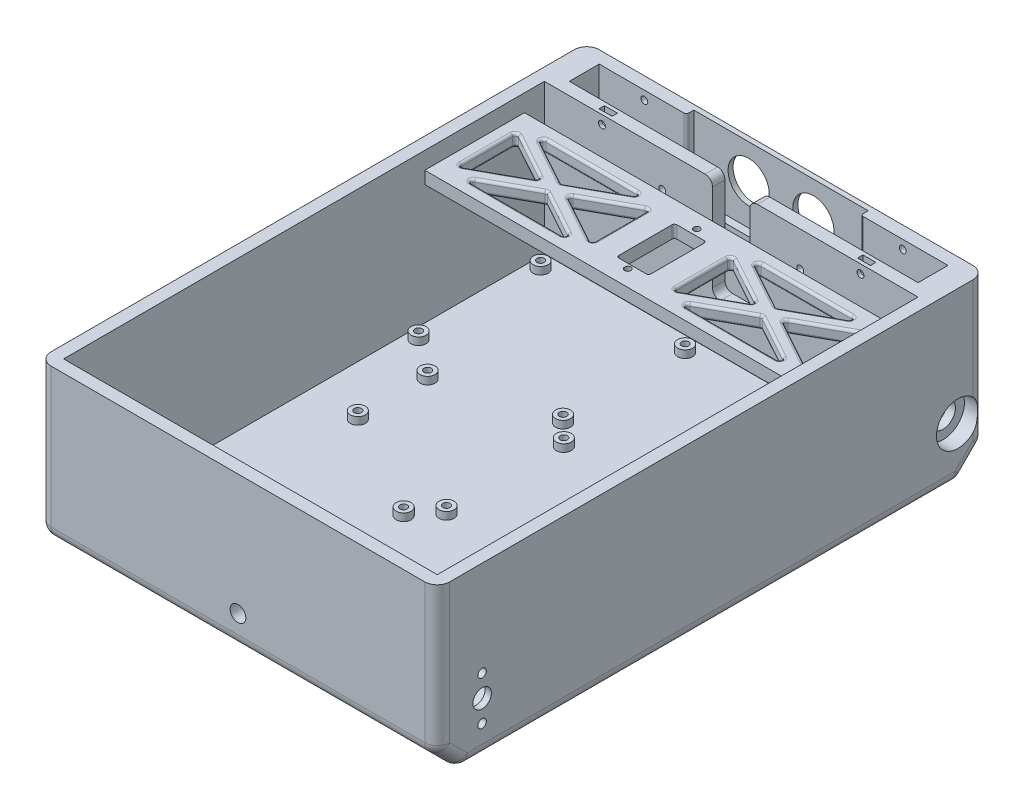
from build123d import *

# Parameters (mm, degrees)
MAIN_BODY_W          = 160
MAIN_BODY_H          = 220
MAIN_BODY_W_2        = 150
MAIN_BODY_H_2        = 210
BOSS_EXTRUDE1_DEPTH  = 8
BOSS_EXTRUDE3_START  = 8
MAIN_BODY_4_W        = 160
MAIN_BODY_4_H        = 220
MAIN_BODY_4_W_2      = 150
MAIN_BODY_4_H_2      = 210
BOSS_EXTRUDE3_DEPTH  = 60
BOSS_EXTRUDE4_DEPTH  = 150
SKETCH2_W            = 26
SKETCH2_H            = 7.5
CUT_EXTRUDE1_DEPTH   = 6
SKETCH3_W            = 5.5
SKETCH3_H            = 26
BOSS_EXTRUDE5_DEPTH  = 20
SKETCH4_W            = 5
SKETCH4_H            = 12
BOSS_EXTRUDE6_DEPTH  = 60
CUT_EXTRUDE4_REACH   = 207.728
SKETCH5_R            = 3.7
SKETCH5_R_2          = 3.5
SKETCH6_R            = 13
CUT_EXTRUDE5_DEPTH   = 2.5
CUT_EXTRUDE6_START   = -2.5
SKETCH8_R            = 13
CUT_EXTRUDE6_DEPTH   = 2.5
CUT_EXTRUDE7_REACH   = 207.728
SKETCH10_R           = 1.7
SKETCH10_R_2         = 1.25
SKETCH14_W           = 9
SKETCH14_H           = 10
BOSS_EXTRUDE9_DEPTH  = 5
CUT_EXTRUDE12_REACH  = 245.77
CUT_EXTRUDE13_REACH  = 154.066
SKETCH16_R           = 1.45
SKETCH16_R_2         = 1.475
BOSS_EXTRUDE11_REACH = 203.864
SKETCH18_W           = 40
SKETCH18_H           = 5
CUT_EXTRUDE14_REACH  = 154.066
SKETCH19_W           = 12.85
SKETCH19_H           = 23.25
CUT_EXTRUDE16_REACH  = 245.77
SKETCH21_R           = 1.375
CUT_EXTRUDE17_DEPTH  = 1.1
SKETCH23_R           = 2.5
CUT_EXTRUDE18_DEPTH  = 1.25
CUT_EXTRUDE19_REACH  = 151.108
SKETCH24_R           = 1.250177724
CUT_EXTRUDE21_REACH  = 151.108
FILLET2_R            = 1
CUT_EXTRUDE27_REACH  = 245.77
SKETCH33_R           = 8.25
CUT_EXTRUDE28_REACH  = 230.545
SKETCH34_R           = 1.375
SKETCH34_R_2         = 1.35
SKETCH35_W           = 15
SKETCH35_H           = 5
CUT_EXTRUDE29_DEPTH  = 41
FILLET4_R            = 3
FILLET5_R            = 1
SKETCH36_W           = 70
SKETCH36_H           = 3
CUT_EXTRUDE30_DEPTH  = 30
FILLET6_R            = 1
SKETCH37_R           = 3
SKETCH37_R_2         = 1.45
SKETCH37_R_3         = 1.475
BOSS_EXTRUDE12_DEPTH = 3
SKETCH38_R           = 8.625
CUT_EXTRUDE31_DEPTH  = 6
SKETCH39_R           = 5
CUT_EXTRUDE32_DEPTH  = 3.5
CHAMFER1_SIZE        = 10
FILLET7_R            = 5


with BuildPart() as part:
    # Main Body → Boss-Extrude1 (new body)
    # profile 1 of 2: a face of its own
    with BuildSketch(Plane(origin=(0, 0, 0), x_dir=(1, 0, 0), z_dir=(0, 1, 0))):
        Rectangle(MAIN_BODY_W, MAIN_BODY_H)
        Rectangle(MAIN_BODY_W_2, MAIN_BODY_H_2, mode=Mode.SUBTRACT)
    # profile 2 of 2: a face of its own
    with BuildSketch(Plane(origin=(0, 0, 0), x_dir=(1, 0, 0), z_dir=(0, 1, 0))):
        Rectangle(MAIN_BODY_W_2, MAIN_BODY_H_2)
    extrude(amount=BOSS_EXTRUDE1_DEPTH)

    # Main Body<4> → Boss-Extrude3 (add)
    with BuildSketch(Plane(origin=(0, 0, 0), x_dir=(1, 0, 0), z_dir=(0, 1, 0)).offset(BOSS_EXTRUDE3_START)):
        Rectangle(MAIN_BODY_4_W, MAIN_BODY_4_H)
        Rectangle(MAIN_BODY_4_W_2, MAIN_BODY_4_H_2, mode=Mode.SUBTRACT)
    extrude(amount=BOSS_EXTRUDE3_DEPTH)

    # Sketch1 → Boss-Extrude4 (add)
    with BuildSketch(Plane.ZY.offset(-75)):
        with BuildLine():
            Line((80.220781011, 15.5), (79, 15.5))
            Line((79, 15.5), (79, 8))
            Line((79, 8), (92, 8))
            ThreePointArc((92, 8), (85.017879978, 10.0341439), (80.220781011, 15.5))
        make_face()
        with BuildLine():
            Line((105, 15.5), (103.779218989, 15.5))
            ThreePointArc((103.779218989, 15.5), (98.982120022, 10.0341439), (92, 8))
            Line((92, 8), (105, 8))
            Line((105, 8), (105, 15.5))
        make_face()
    extrude(amount=BOSS_EXTRUDE4_DEPTH)

    # Sketch2 → Cut-Extrude1 (cut, symmetric)
    with BuildSketch(Plane(origin=(0, 0, 0), x_dir=(0, 0, -1), z_dir=(1, 0, 0))):
        with Locations((-92, 11.75)):
            Rectangle(SKETCH2_W, SKETCH2_H)
    extrude(amount=CUT_EXTRUDE1_DEPTH, both=True, mode=Mode.SUBTRACT)

    # Sketch3 → Boss-Extrude5 (add)
    with BuildSketch(Plane(origin=(0, 8, 0), x_dir=(1, 0, 0), z_dir=(0, 1, 0))):
        with Locations((-7.25, -92)):
            Rectangle(SKETCH3_W, SKETCH3_H)
        with Locations((7.25, -92)):
            Rectangle(SKETCH3_W, SKETCH3_H)
    extrude(amount=BOSS_EXTRUDE5_DEPTH)

    # Sketch4 → Boss-Extrude6 (add)
    with BuildSketch(Plane(origin=(0, 8, 0), x_dir=(1, 0, 0), z_dir=(0, 1, 0))):
        Polygon((-70, 93), (-75, 93), (-75, 88), (75, 88), (75, 93), (70, 93), align=None)
        with Locations((72.5, 99)):
            Rectangle(SKETCH4_W, SKETCH4_H)
        with Locations((-72.5, 99)):
            Rectangle(SKETCH4_W, SKETCH4_H)
    extrude(amount=BOSS_EXTRUDE6_DEPTH)

    # Sketch5 → Cut-Extrude4 (cut, up to next)
    with BuildSketch(Plane(origin=(80, 0, 0), x_dir=(0, 0, -1), z_dir=(1, 0, 0)), mode=Mode.PRIVATE) as cut_extrude4_sk1:
        with Locations((-92, 21)):
            Circle(SKETCH5_R)
        with Locations((-92, 21)):
            Circle(SKETCH5_R_2, mode=Mode.SUBTRACT)
    cut_extrude4_tool1 = extrude(cut_extrude4_sk1.sketch, amount=-CUT_EXTRUDE4_REACH, mode=Mode.PRIVATE) & part.part
    # Sketch5 → Cut-Extrude4 (cut, up to next)
    with BuildSketch(Plane(origin=(80, 0, 0), x_dir=(0, 0, -1), z_dir=(1, 0, 0)), mode=Mode.PRIVATE) as cut_extrude4_sk2:
        with Locations((-92, 21)):
            Circle(SKETCH5_R_2)
    cut_extrude4_tool2 = extrude(cut_extrude4_sk2.sketch, amount=-CUT_EXTRUDE4_REACH, mode=Mode.PRIVATE) & part.part
    cut_extrude4_1 = cut_extrude4_tool1.solids().sort_by_distance((80, 21, 95.595348))[0]
    add(cut_extrude4_1, mode=Mode.SUBTRACT)
    cut_extrude4_2 = cut_extrude4_tool2.solids().sort_by_distance((80, 21, 92))[0]
    add(cut_extrude4_2, mode=Mode.SUBTRACT)
    cut_extrude4 = cut_extrude4_1 + cut_extrude4_2  # Cut-Extrude4 as one shape, for the pattern or mirror that repeats it

    # Sketch6 → Cut-Extrude5 (cut)
    with BuildSketch(Plane(origin=(-75, 0, 0), x_dir=(0, 0, -1), z_dir=(1, 0, 0))):
        with Locations(Location((-92, 21, 0), (0, 0, 180))):
            Circle(SKETCH6_R)
    extrude(amount=-CUT_EXTRUDE5_DEPTH, mode=Mode.SUBTRACT)

    # Mirror1: Cut-Extrude4 across plane
    add(cut_extrude4.mirror(Plane(origin=(0, 0, 0), x_dir=(0, 0, 1), z_dir=(1, 0, 0))), mode=Mode.SUBTRACT)

    # Sketch8 → Cut-Extrude6 (cut)
    with BuildSketch(Plane.ZY.offset(-75).offset(CUT_EXTRUDE6_START)):
        with Locations((92, 21)):
            Circle(SKETCH8_R)
    extrude(amount=CUT_EXTRUDE6_DEPTH, mode=Mode.SUBTRACT)

    # Sketch10 → Cut-Extrude7 (cut, up to next)
    with BuildSketch(Plane(origin=(80, 0, 0), x_dir=(0, 0, -1), z_dir=(1, 0, 0)), mode=Mode.PRIVATE) as cut_extrude7_sk1:
        with Locations((-92, 12.25)):
            Circle(SKETCH10_R)
        with Locations((-92, 12.25)):
            Circle(SKETCH10_R_2, mode=Mode.SUBTRACT)
    cut_extrude7_tool1 = extrude(cut_extrude7_sk1.sketch, amount=-CUT_EXTRUDE7_REACH, mode=Mode.PRIVATE) & part.part
    # Sketch10 → Cut-Extrude7 (cut, up to next)
    with BuildSketch(Plane(origin=(80, 0, 0), x_dir=(0, 0, -1), z_dir=(1, 0, 0)), mode=Mode.PRIVATE) as cut_extrude7_sk2:
        with Locations((-92, 12.25)):
            Circle(SKETCH10_R_2)
    cut_extrude7_tool2 = extrude(cut_extrude7_sk2.sketch, amount=-CUT_EXTRUDE7_REACH, mode=Mode.PRIVATE) & part.part
    # Sketch10 → Cut-Extrude7 (cut, up to next)
    with BuildSketch(Plane(origin=(80, 0, 0), x_dir=(0, 0, -1), z_dir=(1, 0, 0)), mode=Mode.PRIVATE) as cut_extrude7_sk3:
        with Locations((-92, 29.75)):
            Circle(SKETCH10_R)
        with Locations((-92, 29.75)):
            Circle(SKETCH10_R_2, mode=Mode.SUBTRACT)
    cut_extrude7_tool3 = extrude(cut_extrude7_sk3.sketch, amount=-CUT_EXTRUDE7_REACH, mode=Mode.PRIVATE) & part.part
    # Sketch10 → Cut-Extrude7 (cut, up to next)
    with BuildSketch(Plane(origin=(80, 0, 0), x_dir=(0, 0, -1), z_dir=(1, 0, 0)), mode=Mode.PRIVATE) as cut_extrude7_sk4:
        with Locations((-92, 29.75)):
            Circle(SKETCH10_R_2)
    cut_extrude7_tool4 = extrude(cut_extrude7_sk4.sketch, amount=-CUT_EXTRUDE7_REACH, mode=Mode.PRIVATE) & part.part
    cut_extrude7_1 = cut_extrude7_tool1.solids().sort_by_distance((80, 12.25, 93.651917))[0]
    add(cut_extrude7_1, mode=Mode.SUBTRACT)
    cut_extrude7_2 = cut_extrude7_tool2.solids().sort_by_distance((80, 12.25, 92))[0]
    add(cut_extrude7_2, mode=Mode.SUBTRACT)
    cut_extrude7_3 = cut_extrude7_tool3.solids().sort_by_distance((80, 29.75, 93.651917))[0]
    add(cut_extrude7_3, mode=Mode.SUBTRACT)
    cut_extrude7_4 = cut_extrude7_tool4.solids().sort_by_distance((80, 29.75, 92))[0]
    add(cut_extrude7_4, mode=Mode.SUBTRACT)
    cut_extrude7 = cut_extrude7_1 + cut_extrude7_2 + cut_extrude7_3 + cut_extrude7_4  # Cut-Extrude7 as one shape, for the pattern or mirror that repeats it

    # Mirror3: Cut-Extrude7 across plane
    add(cut_extrude7.mirror(Plane(origin=(0, 0, 0), x_dir=(0, 0, 1), z_dir=(1, 0, 0))), mode=Mode.SUBTRACT)

    # Sketch14 → Boss-Extrude9 (add)
    with BuildSketch(Plane(origin=(0, 8, 0), x_dir=(1, 0, 0), z_dir=(0, 1, 0))):
        with Locations((0, -100)):
            Rectangle(SKETCH14_W, SKETCH14_H)
    extrude(amount=BOSS_EXTRUDE9_DEPTH)

    # Sketch15 → Cut-Extrude12 (cut, up to next)
    with BuildSketch(Plane.XY.offset(110), mode=Mode.PRIVATE) as cut_extrude12_sk1:
        with BuildLine():
            ThreePointArc((3.15, 19.5), (0, 22.65), (-3.15, 19.5))
            ThreePointArc((-3.15, 19.5), (0, 16.35), (3.15, 19.5))
        make_face()
    cut_extrude12_tool1 = extrude(cut_extrude12_sk1.sketch, amount=-CUT_EXTRUDE12_REACH, mode=Mode.PRIVATE) & part.part
    add(cut_extrude12_tool1.solids().sort_by_distance((0, 19.5, 110))[0], mode=Mode.SUBTRACT)

    # Sketch16 → Cut-Extrude13 (cut, up to next)
    with BuildSketch(Plane.XZ, mode=Mode.PRIVATE) as cut_extrude13_sk1:
        with Locations(Location((-12.3, 67.68, 0), (0, 0, 270))):
            Circle(SKETCH16_R)
    cut_extrude13_tool1 = extrude(cut_extrude13_sk1.sketch, amount=-CUT_EXTRUDE13_REACH, mode=Mode.PRIVATE) & part.part
    # Sketch16 → Cut-Extrude13 (cut, up to next)
    with BuildSketch(Plane.XZ, mode=Mode.PRIVATE) as cut_extrude13_sk2:
        with Locations(Location((24.2, 67.68, 0), (0, 0, 270))):
            Circle(SKETCH16_R)
    cut_extrude13_tool2 = extrude(cut_extrude13_sk2.sketch, amount=-CUT_EXTRUDE13_REACH, mode=Mode.PRIVATE) & part.part
    # Sketch16 → Cut-Extrude13 (cut, up to next)
    with BuildSketch(Plane.XZ, mode=Mode.PRIVATE) as cut_extrude13_sk3:
        with Locations(Location((37.845895281, 68.243011316, 0), (0, 0, 270))):
            Circle(SKETCH16_R)
    cut_extrude13_tool3 = extrude(cut_extrude13_sk3.sketch, amount=-CUT_EXTRUDE13_REACH, mode=Mode.PRIVATE) & part.part
    # Sketch16 → Cut-Extrude13 (cut, up to next)
    with BuildSketch(Plane.XZ, mode=Mode.PRIVATE) as cut_extrude13_sk4:
        with Locations(Location((59.554104719, 68.243011316, 0), (0, 0, 270))):
            Circle(SKETCH16_R)
    cut_extrude13_tool4 = extrude(cut_extrude13_sk4.sketch, amount=-CUT_EXTRUDE13_REACH, mode=Mode.PRIVATE) & part.part
    # Sketch16 → Cut-Extrude13 (cut, up to next)
    with BuildSketch(Plane.XZ, mode=Mode.PRIVATE) as cut_extrude13_sk5:
        with Locations(Location((-4.2, -25, 0), (0, 0, 270))):
            Circle(SKETCH16_R)
    cut_extrude13_tool5 = extrude(cut_extrude13_sk5.sketch, amount=-CUT_EXTRUDE13_REACH, mode=Mode.PRIVATE) & part.part
    # Sketch16 → Cut-Extrude13 (cut, up to next)
    with BuildSketch(Plane.XZ, mode=Mode.PRIVATE) as cut_extrude13_sk6:
        with Locations(Location((-70.5, -33, 0), (0, 0, 270))):
            Circle(SKETCH16_R)
    cut_extrude13_tool6 = extrude(cut_extrude13_sk6.sketch, amount=-CUT_EXTRUDE13_REACH, mode=Mode.PRIVATE) & part.part
    # Sketch16 → Cut-Extrude13 (cut, up to next)
    with BuildSketch(Plane.XZ, mode=Mode.PRIVATE) as cut_extrude13_sk7:
        with Locations(Location((-55, -21.12, 0), (0, 0, 270))):
            Circle(SKETCH16_R)
    cut_extrude13_tool7 = extrude(cut_extrude13_sk7.sketch, amount=-CUT_EXTRUDE13_REACH, mode=Mode.PRIVATE) & part.part
    # Sketch16 → Cut-Extrude13 (cut, up to next)
    with BuildSketch(Plane.XZ, mode=Mode.PRIVATE) as cut_extrude13_sk8:
        with Locations(Location((-55, 6.88, 0), (0, 0, 270))):
            Circle(SKETCH16_R)
    cut_extrude13_tool8 = extrude(cut_extrude13_sk8.sketch, amount=-CUT_EXTRUDE13_REACH, mode=Mode.PRIVATE) & part.part
    # Sketch16 → Cut-Extrude13 (cut, up to next)
    with BuildSketch(Plane.XZ, mode=Mode.PRIVATE) as cut_extrude13_sk9:
        with Locations(Location((-12.3, 31.18, 0), (0, 0, 270))):
            Circle(SKETCH16_R)
    cut_extrude13_tool9 = extrude(cut_extrude13_sk9.sketch, amount=-CUT_EXTRUDE13_REACH, mode=Mode.PRIVATE) & part.part
    # Sketch16 → Cut-Extrude13 (cut, up to next)
    with BuildSketch(Plane.XZ, mode=Mode.PRIVATE) as cut_extrude13_sk10:
        with Locations(Location((-4.2, 22.08, 0), (0, 0, 270))):
            Circle(SKETCH16_R)
    cut_extrude13_tool10 = extrude(cut_extrude13_sk10.sketch, amount=-CUT_EXTRUDE13_REACH, mode=Mode.PRIVATE) & part.part
    # Sketch16 → Cut-Extrude13 (cut, up to next)
    with BuildSketch(Plane.XZ, mode=Mode.PRIVATE) as cut_extrude13_sk11:
        with Locations(Location((24.2, 31.18, 0), (0, 0, 270))):
            Circle(SKETCH16_R)
    cut_extrude13_tool11 = extrude(cut_extrude13_sk11.sketch, amount=-CUT_EXTRUDE13_REACH, mode=Mode.PRIVATE) & part.part
    # Sketch16 → Cut-Extrude13 (cut, up to next)
    with BuildSketch(Plane.XZ, mode=Mode.PRIVATE) as cut_extrude13_sk12:
        with Locations(Location((37.845895281, 24.116988684, 0), (0, 0, 270))):
            Circle(SKETCH16_R)
    cut_extrude13_tool12 = extrude(cut_extrude13_sk12.sketch, amount=-CUT_EXTRUDE13_REACH, mode=Mode.PRIVATE) & part.part
    # Sketch16 → Cut-Extrude13 (cut, up to next)
    with BuildSketch(Plane.XZ, mode=Mode.PRIVATE) as cut_extrude13_sk13:
        with Locations(Location((59.554104719, 24.116988684, 0), (0, 0, 270))):
            Circle(SKETCH16_R)
    cut_extrude13_tool13 = extrude(cut_extrude13_sk13.sketch, amount=-CUT_EXTRUDE13_REACH, mode=Mode.PRIVATE) & part.part
    # Sketch16 → Cut-Extrude13 (cut, up to next)
    with BuildSketch(Plane.XZ, mode=Mode.PRIVATE) as cut_extrude13_sk14:
        with Locations(Location((-70.5, -82, 0), (0, 0, 270))):
            Circle(SKETCH16_R)
    cut_extrude13_tool14 = extrude(cut_extrude13_sk14.sketch, amount=-CUT_EXTRUDE13_REACH, mode=Mode.PRIVATE) & part.part
    # Sketch16 → Cut-Extrude13 (cut, up to next)
    with BuildSketch(Plane.XZ, mode=Mode.PRIVATE) as cut_extrude13_sk15:
        with Locations(Location((-12.5, -82, 0), (0, 0, 270))):
            Circle(SKETCH16_R)
    cut_extrude13_tool15 = extrude(cut_extrude13_sk15.sketch, amount=-CUT_EXTRUDE13_REACH, mode=Mode.PRIVATE) & part.part
    # Sketch16 → Cut-Extrude13 (cut, up to next)
    with BuildSketch(Plane.XZ, mode=Mode.PRIVATE) as cut_extrude13_sk16:
        with Locations(Location((-12.5, -33, 0), (0, 0, 270))):
            Circle(SKETCH16_R_2)
    cut_extrude13_tool16 = extrude(cut_extrude13_sk16.sketch, amount=-CUT_EXTRUDE13_REACH, mode=Mode.PRIVATE) & part.part
    add(cut_extrude13_tool1.solids().sort_by_distance((-12.3, 0, 67.68))[0], mode=Mode.SUBTRACT)
    add(cut_extrude13_tool2.solids().sort_by_distance((24.2, 0, 67.68))[0], mode=Mode.SUBTRACT)
    add(cut_extrude13_tool3.solids().sort_by_distance((37.845895, 0, 68.243011))[0], mode=Mode.SUBTRACT)
    add(cut_extrude13_tool4.solids().sort_by_distance((59.554105, 0, 68.243011))[0], mode=Mode.SUBTRACT)
    add(cut_extrude13_tool5.solids().sort_by_distance((-4.2, 0, -25))[0], mode=Mode.SUBTRACT)
    add(cut_extrude13_tool6.solids().sort_by_distance((-70.5, 0, -33))[0], mode=Mode.SUBTRACT)
    add(cut_extrude13_tool7.solids().sort_by_distance((-55, 0, -21.12))[0], mode=Mode.SUBTRACT)
    add(cut_extrude13_tool8.solids().sort_by_distance((-55, 0, 6.88))[0], mode=Mode.SUBTRACT)
    add(cut_extrude13_tool9.solids().sort_by_distance((-12.3, 0, 31.18))[0], mode=Mode.SUBTRACT)
    add(cut_extrude13_tool10.solids().sort_by_distance((-4.2, 0, 22.08))[0], mode=Mode.SUBTRACT)
    add(cut_extrude13_tool11.solids().sort_by_distance((24.2, 0, 31.18))[0], mode=Mode.SUBTRACT)
    add(cut_extrude13_tool12.solids().sort_by_distance((37.845895, 0, 24.116989))[0], mode=Mode.SUBTRACT)
    add(cut_extrude13_tool13.solids().sort_by_distance((59.554105, 0, 24.116989))[0], mode=Mode.SUBTRACT)
    add(cut_extrude13_tool14.solids().sort_by_distance((-70.5, 0, -82))[0], mode=Mode.SUBTRACT)
    add(cut_extrude13_tool15.solids().sort_by_distance((-12.5, 0, -82))[0], mode=Mode.SUBTRACT)
    add(cut_extrude13_tool16.solids().sort_by_distance((-12.5, 0, -33))[0], mode=Mode.SUBTRACT)

    # Sketch18 → Boss-Extrude11 (add, up to next)
    with BuildSketch(Plane.ZY.offset(-75), mode=Mode.PRIVATE) as boss_extrude11_sk1:
        with Locations((-60, 58.6)):
            Rectangle(SKETCH18_W, SKETCH18_H)
    boss_extrude11_tool1 = extrude(boss_extrude11_sk1.sketch, amount=BOSS_EXTRUDE11_REACH, mode=Mode.PRIVATE) - part.part
    add(boss_extrude11_tool1.solids().sort_by_distance((75, 58.6, -60))[0])

    # Sketch19 → Cut-Extrude14 (cut, up to next)
    with BuildSketch(Plane(origin=(0, 68, 0), x_dir=(1, 0, 0), z_dir=(0, 1, 0)), mode=Mode.PRIVATE) as cut_extrude14_sk1:
        with Locations((0, 60)):
            Rectangle(SKETCH19_W, SKETCH19_H)
    cut_extrude14_tool1 = extrude(cut_extrude14_sk1.sketch, amount=-CUT_EXTRUDE14_REACH, mode=Mode.PRIVATE) & part.part
    add(cut_extrude14_tool1.solids().sort_by_distance((0, 68, -60))[0], mode=Mode.SUBTRACT)

    # Cut-Extrude16: up to this face of the body (flat: up to its plane)
    cut_extrude16_end = Plane(part.part.faces().sort_by_distance((0, 38, -88))[0])
    # Sketch21 → Cut-Extrude16 (cut, up to the picked face)
    with BuildSketch(Plane(origin=(0, 0, -110), x_dir=(-1, 0, 0), z_dir=(0, 0, -1)), mode=Mode.PRIVATE) as cut_extrude16_sk1:
        with Locations((-51.875, 64.5)):
            Circle(SKETCH21_R)
    cut_extrude16_tool1 = split(extrude(cut_extrude16_sk1.sketch, amount=-CUT_EXTRUDE16_REACH, mode=Mode.PRIVATE), bisect_by=cut_extrude16_end, keep=Keep.BOTH, mode=Mode.PRIVATE)
    # Sketch21 → Cut-Extrude16 (cut, up to the picked face)
    with BuildSketch(Plane(origin=(0, 0, -110), x_dir=(-1, 0, 0), z_dir=(0, 0, -1)), mode=Mode.PRIVATE) as cut_extrude16_sk2:
        with Locations((51.875, 64.5)):
            Circle(SKETCH21_R)
    cut_extrude16_tool2 = split(extrude(cut_extrude16_sk2.sketch, amount=-CUT_EXTRUDE16_REACH, mode=Mode.PRIVATE), bisect_by=cut_extrude16_end, keep=Keep.BOTH, mode=Mode.PRIVATE)
    add(cut_extrude16_tool1.solids().sort_by(Axis((51.875, 64.5, -110), (0, 0, 1)))[0], mode=Mode.SUBTRACT)
    add(cut_extrude16_tool2.solids().sort_by(Axis((-51.875, 64.5, -110), (0, 0, 1)))[0], mode=Mode.SUBTRACT)

    # Sketch22 → Cut-Extrude17 (cut, symmetric)
    with BuildSketch(Plane(origin=(0, 0, -90.5), x_dir=(-1, 0, 0), z_dir=(0, 0, -1))):
        Polygon((49.275, 66.0011107), (51.875, 67.5022214), (54.475, 66.0011107), (54.475, 62.9988893), (51.875, 61.4977786), (49.275, 62.9988893), align=None)
        Polygon((49.275, 68), (49.275, 66.0011107), (51.875, 67.5022214), (54.475, 66.0011107), (54.475, 68), align=None)
        Polygon((-51.875, 61.4977786), (-49.275, 62.9988893), (-49.275, 66.0011107), (-51.875, 67.5022214), (-54.475, 66.0011107), (-54.475, 62.9988893), align=None)
        Polygon((-49.275, 68), (-49.275, 66.0011107), (-51.875, 67.5022214), (-54.475, 66.0011107), (-54.475, 68), align=None)
    extrude(amount=CUT_EXTRUDE17_DEPTH, both=True, mode=Mode.SUBTRACT)

    # Sketch23 → Cut-Extrude18 (cut, symmetric)
    with BuildSketch(Plane(origin=(0, 0, -110), x_dir=(-1, 0, 0), z_dir=(0, 0, -1))):
        with Locations((51.875, 64.5)):
            Circle(SKETCH23_R)
        with Locations((-51.875, 64.5)):
            Circle(SKETCH23_R)
    extrude(amount=CUT_EXTRUDE18_DEPTH, both=True, mode=Mode.SUBTRACT)

    # Sketch24 → Cut-Extrude19 (cut, up to next)
    with BuildSketch(Plane(origin=(0, 61.1, 0), x_dir=(1, 0, 0), z_dir=(0, 1, 0)), mode=Mode.PRIVATE) as cut_extrude19_sk1:
        with Locations(Location((0, 46.475, 0), (0, 0, 270))):
            Circle(SKETCH24_R)
    cut_extrude19_tool1 = extrude(cut_extrude19_sk1.sketch, amount=-CUT_EXTRUDE19_REACH, mode=Mode.PRIVATE) & part.part
    # Sketch24 → Cut-Extrude19 (cut, up to next)
    with BuildSketch(Plane(origin=(0, 61.1, 0), x_dir=(1, 0, 0), z_dir=(0, 1, 0)), mode=Mode.PRIVATE) as cut_extrude19_sk2:
        with Locations(Location((0, 74.175, 0), (0, 0, 270))):
            Circle(SKETCH24_R)
    cut_extrude19_tool2 = extrude(cut_extrude19_sk2.sketch, amount=-CUT_EXTRUDE19_REACH, mode=Mode.PRIVATE) & part.part
    add(cut_extrude19_tool1.solids().sort_by_distance((0, 61.1, -46.475))[0], mode=Mode.SUBTRACT)
    add(cut_extrude19_tool2.solids().sort_by_distance((0, 61.1, -74.175))[0], mode=Mode.SUBTRACT)

    # Sketch25 → Cut-Extrude21 (cut, up to next)
    with BuildSketch(Plane(origin=(0, 61.1, 0), x_dir=(1, 0, 0), z_dir=(0, 1, 0)), mode=Mode.PRIVATE) as cut_extrude21_sk1:
        Polygon((-43.15, 57.145791444), (-65.198988069, 45), (-21.101011931, 45), align=None)
    cut_extrude21_tool1 = extrude(cut_extrude21_sk1.sketch, amount=-CUT_EXTRUDE21_REACH, mode=Mode.PRIVATE) & part.part
    # Sketch25 → Cut-Extrude21 (cut, up to next)
    with BuildSketch(Plane(origin=(0, 61.1, 0), x_dir=(1, 0, 0), z_dir=(0, 1, 0)), mode=Mode.PRIVATE) as cut_extrude21_sk2:
        Polygon((-48.331417011, 60), (-70, 71.93624347), (-70, 48.06375653), align=None)
    cut_extrude21_tool2 = extrude(cut_extrude21_sk2.sketch, amount=-CUT_EXTRUDE21_REACH, mode=Mode.PRIVATE) & part.part
    # Sketch25 → Cut-Extrude21 (cut, up to next)
    with BuildSketch(Plane(origin=(0, 61.1, 0), x_dir=(1, 0, 0), z_dir=(0, 1, 0)), mode=Mode.PRIVATE) as cut_extrude21_sk3:
        Polygon((-21.101011931, 75), (-65.198988069, 75), (-43.15, 62.854208556), align=None)
    cut_extrude21_tool3 = extrude(cut_extrude21_sk3.sketch, amount=-CUT_EXTRUDE21_REACH, mode=Mode.PRIVATE) & part.part
    # Sketch25 → Cut-Extrude21 (cut, up to next)
    with BuildSketch(Plane(origin=(0, 61.1, 0), x_dir=(1, 0, 0), z_dir=(0, 1, 0)), mode=Mode.PRIVATE) as cut_extrude21_sk4:
        Polygon((-16.3, 48.06375653), (-16.3, 71.93624347), (-37.968582989, 60), align=None)
    cut_extrude21_tool4 = extrude(cut_extrude21_sk4.sketch, amount=-CUT_EXTRUDE21_REACH, mode=Mode.PRIVATE) & part.part
    # Sketch25 → Cut-Extrude21 (cut, up to next)
    with BuildSketch(Plane(origin=(0, 61.1, 0), x_dir=(1, 0, 0), z_dir=(0, 1, 0)), mode=Mode.PRIVATE) as cut_extrude21_sk5:
        Polygon((37.968582989, 60), (16.3, 71.93624347), (16.3, 48.06375653), align=None)
    cut_extrude21_tool5 = extrude(cut_extrude21_sk5.sketch, amount=-CUT_EXTRUDE21_REACH, mode=Mode.PRIVATE) & part.part
    # Sketch25 → Cut-Extrude21 (cut, up to next)
    with BuildSketch(Plane(origin=(0, 61.1, 0), x_dir=(1, 0, 0), z_dir=(0, 1, 0)), mode=Mode.PRIVATE) as cut_extrude21_sk6:
        Polygon((43.15, 62.854208556), (65.198988069, 75), (21.101011931, 75), align=None)
    cut_extrude21_tool6 = extrude(cut_extrude21_sk6.sketch, amount=-CUT_EXTRUDE21_REACH, mode=Mode.PRIVATE) & part.part
    # Sketch25 → Cut-Extrude21 (cut, up to next)
    with BuildSketch(Plane(origin=(0, 61.1, 0), x_dir=(1, 0, 0), z_dir=(0, 1, 0)), mode=Mode.PRIVATE) as cut_extrude21_sk7:
        Polygon((21.101011931, 45), (65.198988069, 45), (43.15, 57.145791444), align=None)
    cut_extrude21_tool7 = extrude(cut_extrude21_sk7.sketch, amount=-CUT_EXTRUDE21_REACH, mode=Mode.PRIVATE) & part.part
    # Sketch25 → Cut-Extrude21 (cut, up to next)
    with BuildSketch(Plane(origin=(0, 61.1, 0), x_dir=(1, 0, 0), z_dir=(0, 1, 0)), mode=Mode.PRIVATE) as cut_extrude21_sk8:
        Polygon((70, 48.06375653), (70, 71.93624347), (48.331417011, 60), align=None)
    cut_extrude21_tool8 = extrude(cut_extrude21_sk8.sketch, amount=-CUT_EXTRUDE21_REACH, mode=Mode.PRIVATE) & part.part
    add(cut_extrude21_tool1.solids().sort_by_distance((-43.15, 61.1, -49.048597))[0], mode=Mode.SUBTRACT)
    add(cut_extrude21_tool2.solids().sort_by_distance((-62.777139, 61.1, -60))[0], mode=Mode.SUBTRACT)
    add(cut_extrude21_tool3.solids().sort_by_distance((-43.15, 61.1, -70.951403))[0], mode=Mode.SUBTRACT)
    add(cut_extrude21_tool4.solids().sort_by_distance((-23.522861, 61.1, -60))[0], mode=Mode.SUBTRACT)
    add(cut_extrude21_tool5.solids().sort_by_distance((23.522861, 61.1, -60))[0], mode=Mode.SUBTRACT)
    add(cut_extrude21_tool6.solids().sort_by_distance((43.15, 61.1, -70.951403))[0], mode=Mode.SUBTRACT)
    add(cut_extrude21_tool7.solids().sort_by_distance((43.15, 61.1, -49.048597))[0], mode=Mode.SUBTRACT)
    add(cut_extrude21_tool8.solids().sort_by_distance((62.777139, 61.1, -60))[0], mode=Mode.SUBTRACT)

    # Fillet2
    fillet2_edges = [part.edges().sort_by_distance(p)[0] for p in [
        (-6.425, 58.6, -71.625),
        (-6.425, 58.6, -48.375),
        (6.425, 58.6, -48.375),
        (6.425, 58.6, -71.625),
        (27.134291494, 56.1, -54.031878265),
        (37.968582989, 58.6, -60),
        (27.134291494, 61.1, -54.031878265),
        (16.3, 58.6, -48.06375653),
        (27.134291494, 56.1, -65.968121735),
        (16.3, 58.6, -71.93624347),
        (27.134291494, 61.1, -65.968121735),
        (16.3, 61.1, -60),
        (16.3, 56.1, -60),
        (-37.968582989, 58.6, -60),
        (-16.3, 56.1, -60),
        (-16.3, 58.6, -71.93624347),
        (-16.3, 61.1, -60),
        (-16.3, 58.6, -48.06375653),
        (-27.134291494, 61.1, -65.968121735),
        (-27.134291494, 61.1, -54.031878265),
        (-27.134291494, 56.1, -54.031878265),
        (-27.134291494, 56.1, -65.968121735),
        (-59.165708506, 56.1, -54.031878265),
        (-48.331417011, 58.6, -60),
        (-59.165708506, 61.1, -54.031878265),
        (-70, 58.6, -48.06375653),
        (-59.165708506, 56.1, -65.968121735),
        (-70, 58.6, -71.93624347),
        (-59.165708506, 61.1, -65.968121735),
        (-70, 61.1, -60),
        (-70, 56.1, -60),
        (-43.15, 58.6, -62.854208556),
        (-43.15, 56.1, -75),
        (-65.198988069, 58.6, -75),
        (-43.15, 61.1, -75),
        (-21.101011931, 58.6, -75),
        (-54.174494034, 61.1, -68.927104278),
        (-32.125505966, 61.1, -68.927104278),
        (-32.125505966, 56.1, -68.927104278),
        (-54.174494034, 56.1, -68.927104278),
        (48.331417011, 58.6, -60),
        (70, 56.1, -60),
        (70, 58.6, -71.93624347),
        (70, 61.1, -60),
        (70, 58.6, -48.06375653),
        (59.165708506, 61.1, -65.968121735),
        (59.165708506, 61.1, -54.031878265),
        (59.165708506, 56.1, -54.031878265),
        (59.165708506, 56.1, -65.968121735),
        (43.15, 58.6, -57.145791444),
        (43.15, 56.1, -45),
        (65.198988069, 58.6, -45),
        (43.15, 61.1, -45),
        (21.101011931, 58.6, -45),
        (54.174494034, 61.1, -51.072895722),
        (32.125505966, 61.1, -51.072895722),
        (32.125505966, 56.1, -51.072895722),
        (54.174494034, 56.1, -51.072895722),
        (32.125505966, 56.1, -68.927104278),
        (43.15, 58.6, -62.854208556),
        (32.125505966, 61.1, -68.927104278),
        (21.101011931, 58.6, -75),
        (54.174494034, 56.1, -68.927104278),
        (65.198988069, 58.6, -75),
        (54.174494034, 61.1, -68.927104278),
        (43.15, 61.1, -75),
        (43.15, 56.1, -75),
        (-32.125505966, 56.1, -51.072895722),
        (-43.15, 58.6, -57.145791444),
        (-32.125505966, 61.1, -51.072895722),
        (-21.101011931, 58.6, -45),
        (-54.174494034, 56.1, -51.072895722),
        (-65.198988069, 58.6, -45),
        (-54.174494034, 61.1, -51.072895722),
        (-43.15, 61.1, -45),
        (-43.15, 56.1, -45),
    ]]
    fillet(fillet2_edges, radius=FILLET2_R)

    # Sketch33 → Cut-Extrude27 (cut, up to next)
    with BuildSketch(Plane(origin=(0, 0, -110), x_dir=(-1, 0, 0), z_dir=(0, 0, -1)), mode=Mode.PRIVATE) as cut_extrude27_sk1:
        with Locations((-13, 53.999893)):
            Circle(SKETCH33_R)
    cut_extrude27_tool1 = extrude(cut_extrude27_sk1.sketch, amount=-CUT_EXTRUDE27_REACH, mode=Mode.PRIVATE) & part.part
    # Sketch33 → Cut-Extrude27 (cut, up to next)
    with BuildSketch(Plane(origin=(0, 0, -110), x_dir=(-1, 0, 0), z_dir=(0, 0, -1)), mode=Mode.PRIVATE) as cut_extrude27_sk2:
        with Locations((13, 53.999893)):
            Circle(SKETCH33_R)
    cut_extrude27_tool2 = extrude(cut_extrude27_sk2.sketch, amount=-CUT_EXTRUDE27_REACH, mode=Mode.PRIVATE) & part.part
    add(cut_extrude27_tool1.solids().sort_by_distance((13, 53.999893, -110))[0], mode=Mode.SUBTRACT)
    add(cut_extrude27_tool2.solids().sort_by_distance((-13, 53.999893, -110))[0], mode=Mode.SUBTRACT)

    # Sketch34 → Cut-Extrude28 (cut, up to next)
    with BuildSketch(Plane(origin=(0, 0, -93), x_dir=(-1, 0, 0), z_dir=(0, 0, -1)), mode=Mode.PRIVATE) as cut_extrude28_sk1:
        with Locations((-27.7, 54)):
            Circle(SKETCH34_R)
        with Locations((-27.7, 54)):
            Circle(SKETCH34_R_2, mode=Mode.SUBTRACT)
    cut_extrude28_tool1 = extrude(cut_extrude28_sk1.sketch, amount=-CUT_EXTRUDE28_REACH, mode=Mode.PRIVATE) & part.part
    # Sketch34 → Cut-Extrude28 (cut, up to next)
    with BuildSketch(Plane(origin=(0, 0, -93), x_dir=(-1, 0, 0), z_dir=(0, 0, -1)), mode=Mode.PRIVATE) as cut_extrude28_sk2:
        with Locations((27.7, 54)):
            Circle(SKETCH34_R)
        with Locations((27.7, 54)):
            Circle(SKETCH34_R_2, mode=Mode.SUBTRACT)
    cut_extrude28_tool2 = extrude(cut_extrude28_sk2.sketch, amount=-CUT_EXTRUDE28_REACH, mode=Mode.PRIVATE) & part.part
    # Sketch34 → Cut-Extrude28 (cut, up to next)
    with BuildSketch(Plane(origin=(0, 0, -93), x_dir=(-1, 0, 0), z_dir=(0, 0, -1)), mode=Mode.PRIVATE) as cut_extrude28_sk3:
        with Locations((27.7, 54)):
            Circle(SKETCH34_R_2)
    cut_extrude28_tool3 = extrude(cut_extrude28_sk3.sketch, amount=-CUT_EXTRUDE28_REACH, mode=Mode.PRIVATE) & part.part
    add(cut_extrude28_tool1.solids().sort_by_distance((29.071111, 54, -93))[0], mode=Mode.SUBTRACT)
    add(cut_extrude28_tool2.solids().sort_by_distance((-26.328889, 54, -93))[0], mode=Mode.SUBTRACT)
    add(cut_extrude28_tool3.solids().sort_by_distance((-27.7, 54, -93))[0], mode=Mode.SUBTRACT)


with BuildPart() as cut_extrude28_kept_piece:
    # of the separate pieces the step leaves, the one the design keeps (cut_extrude28_pieces_kept)
    add(part.part.solids().sort_by_distance((6.425, 56.1, -70.625))[0])

    # Sketch35 → Cut-Extrude29 (cut)
    with BuildSketch(Plane(origin=(0, 68, 0), x_dir=(1, 0, 0), z_dir=(0, 1, 0))):
        with Locations((0, 90.5)):
            Rectangle(SKETCH35_W, SKETCH35_H)
    extrude(amount=-CUT_EXTRUDE29_DEPTH, mode=Mode.SUBTRACT)

    # Fillet4
    fillet4_edges = [cut_extrude28_kept_piece.edges().sort_by_distance(p)[0] for p in [
        (-7.25, 28, 79),
        (-7.25, 28, 105),
        (7.25, 28, 79),
        (7.25, 28, 105),
        (0, 8, 95),
        (7.5, 68, -90.5),
        (-7.5, 68, -90.5),
        (7.5, 27, -90.5),
        (-7.5, 27, -90.5),
    ]]
    fillet(fillet4_edges, radius=FILLET4_R)

    # Fillet5
    fillet5_edges = [cut_extrude28_kept_piece.edges().sort_by_distance(p)[0] for p in [
        (0, 13, 95),
    ]]
    fillet(fillet5_edges, radius=FILLET5_R)

    # Sketch36 → Cut-Extrude30 (cut)
    with BuildSketch(Plane(origin=(0, 68, 0), x_dir=(1, 0, 0), z_dir=(0, 1, 0))):
        with Locations((0, 106.5)):
            Rectangle(SKETCH36_W, SKETCH36_H)
    extrude(amount=-CUT_EXTRUDE30_DEPTH, mode=Mode.SUBTRACT)

    # Fillet6
    fillet6_edges = [cut_extrude28_kept_piece.edges().sort_by_distance(p)[0] for p in [
        (35, 53, -105),
        (-35, 53, -105),
    ]]
    fillet(fillet6_edges, radius=FILLET6_R)

    # Sketch37 → Boss-Extrude12 (add)
    # profile 1 of 16: a face of its own
    with BuildSketch(Plane(origin=(0, 8, 0), x_dir=(1, 0, 0), z_dir=(0, 1, 0))):
        with Locations(Location((-12.3, -67.68, 0), (0, 0, 270))):
            Circle(SKETCH37_R)
        with Locations(Location((-12.3, -67.68, 0), (0, 0, 90))):
            Circle(SKETCH37_R_2, mode=Mode.SUBTRACT)
    # profile 2 of 16: a face of its own
    with BuildSketch(Plane(origin=(0, 8, 0), x_dir=(1, 0, 0), z_dir=(0, 1, 0))):
        with Locations(Location((24.2, -67.68, 0), (0, 0, 270))):
            Circle(SKETCH37_R)
        with Locations(Location((24.2, -67.68, 0), (0, 0, 90))):
            Circle(SKETCH37_R_2, mode=Mode.SUBTRACT)
    # profile 3 of 16: a face of its own
    with BuildSketch(Plane(origin=(0, 8, 0), x_dir=(1, 0, 0), z_dir=(0, 1, 0))):
        with Locations(Location((37.845895281, -68.243011316, 0), (0, 0, 270))):
            Circle(SKETCH37_R)
        with Locations(Location((37.845895281, -68.243011316, 0), (0, 0, 90))):
            Circle(SKETCH37_R_2, mode=Mode.SUBTRACT)
    # profile 4 of 16: a face of its own
    with BuildSketch(Plane(origin=(0, 8, 0), x_dir=(1, 0, 0), z_dir=(0, 1, 0))):
        with Locations(Location((59.554104719, -68.243011316, 0), (0, 0, 270))):
            Circle(SKETCH37_R)
        with Locations(Location((59.554104719, -68.243011316, 0), (0, 0, 90))):
            Circle(SKETCH37_R_2, mode=Mode.SUBTRACT)
    # profile 5 of 16: a face of its own
    with BuildSketch(Plane(origin=(0, 8, 0), x_dir=(1, 0, 0), z_dir=(0, 1, 0))):
        with Locations(Location((24.2, -31.18, 0), (0, 0, 270))):
            Circle(SKETCH37_R)
        with Locations(Location((24.2, -31.18, 0), (0, 0, 90))):
            Circle(SKETCH37_R_2, mode=Mode.SUBTRACT)
    # profile 6 of 16: a face of its own
    with BuildSketch(Plane(origin=(0, 8, 0), x_dir=(1, 0, 0), z_dir=(0, 1, 0))):
        with Locations(Location((37.845895281, -24.116988684, 0), (0, 0, 270))):
            Circle(SKETCH37_R)
        with Locations(Location((37.845895281, -24.116988684, 0), (0, 0, 90))):
            Circle(SKETCH37_R_2, mode=Mode.SUBTRACT)
    # profile 7 of 16: a face of its own
    with BuildSketch(Plane(origin=(0, 8, 0), x_dir=(1, 0, 0), z_dir=(0, 1, 0))):
        with Locations(Location((59.554104719, -24.116988684, 0), (0, 0, 270))):
            Circle(SKETCH37_R)
        with Locations(Location((59.554104719, -24.116988684, 0), (0, 0, 90))):
            Circle(SKETCH37_R_2, mode=Mode.SUBTRACT)
    # profile 8 of 16: a face of its own
    with BuildSketch(Plane(origin=(0, 8, 0), x_dir=(1, 0, 0), z_dir=(0, 1, 0))):
        with Locations(Location((-4.2, -22.08, 0), (0, 0, 270))):
            Circle(SKETCH37_R)
        with Locations(Location((-4.2, -22.08, 0), (0, 0, 90))):
            Circle(SKETCH37_R_2, mode=Mode.SUBTRACT)
    # profile 9 of 16: a face of its own
    with BuildSketch(Plane(origin=(0, 8, 0), x_dir=(1, 0, 0), z_dir=(0, 1, 0))):
        with Locations(Location((-12.3, -31.18, 0), (0, 0, 270))):
            Circle(SKETCH37_R)
        with Locations(Location((-12.3, -31.18, 0), (0, 0, 90))):
            Circle(SKETCH37_R_2, mode=Mode.SUBTRACT)
    # profile 10 of 16: a face of its own
    with BuildSketch(Plane(origin=(0, 8, 0), x_dir=(1, 0, 0), z_dir=(0, 1, 0))):
        with Locations(Location((-4.2, 25, 0), (0, 0, 270))):
            Circle(SKETCH37_R)
        with Locations(Location((-4.2, 25, 0), (0, 0, 90))):
            Circle(SKETCH37_R_2, mode=Mode.SUBTRACT)
    # profile 11 of 16: a face of its own
    with BuildSketch(Plane(origin=(0, 8, 0), x_dir=(1, 0, 0), z_dir=(0, 1, 0))):
        with Locations(Location((-55, -6.88, 0), (0, 0, 270))):
            Circle(SKETCH37_R)
        with Locations(Location((-55, -6.88, 0), (0, 0, 90))):
            Circle(SKETCH37_R_2, mode=Mode.SUBTRACT)
    # profile 12 of 16: a face of its own
    with BuildSketch(Plane(origin=(0, 8, 0), x_dir=(1, 0, 0), z_dir=(0, 1, 0))):
        with Locations(Location((-55, 21.12, 0), (0, 0, 270))):
            Circle(SKETCH37_R)
        with Locations(Location((-55, 21.12, 0), (0, 0, 90))):
            Circle(SKETCH37_R_2, mode=Mode.SUBTRACT)
    # profile 13 of 16: a face of its own
    with BuildSketch(Plane(origin=(0, 8, 0), x_dir=(1, 0, 0), z_dir=(0, 1, 0))):
        with Locations(Location((-12.5, 33, 0), (0, 0, 270))):
            Circle(SKETCH37_R)
        with Locations(Location((-12.5, 33, 0), (0, 0, 90))):
            Circle(SKETCH37_R_3, mode=Mode.SUBTRACT)
    # profile 14 of 16: a face of its own
    with BuildSketch(Plane(origin=(0, 8, 0), x_dir=(1, 0, 0), z_dir=(0, 1, 0))):
        with Locations(Location((-12.5, 82, 0), (0, 0, 270))):
            Circle(SKETCH37_R)
        with Locations(Location((-12.5, 82, 0), (0, 0, 90))):
            Circle(SKETCH37_R_2, mode=Mode.SUBTRACT)
    # profile 15 of 16: a face of its own
    with BuildSketch(Plane(origin=(0, 8, 0), x_dir=(1, 0, 0), z_dir=(0, 1, 0))):
        with Locations(Location((-70.5, 82, 0), (0, 0, 270))):
            Circle(SKETCH37_R)
        with Locations(Location((-70.5, 82, 0), (0, 0, 90))):
            Circle(SKETCH37_R_2, mode=Mode.SUBTRACT)
    # profile 16 of 16: a face of its own
    with BuildSketch(Plane(origin=(0, 8, 0), x_dir=(1, 0, 0), z_dir=(0, 1, 0))):
        with Locations(Location((-70.5, 33, 0), (0, 0, 270))):
            Circle(SKETCH37_R)
        with Locations(Location((-70.5, 33, 0), (0, 0, 90))):
            Circle(SKETCH37_R_2, mode=Mode.SUBTRACT)
    extrude(amount=BOSS_EXTRUDE12_DEPTH)

    # Sketch38 → Cut-Extrude31 (cut)
    with BuildSketch(Plane(origin=(80, 0, 0), x_dir=(0, 0, -1), z_dir=(1, 0, 0))):
        with Locations((99, 21)):
            Circle(SKETCH38_R)
    cut_extrude31 = extrude(amount=-CUT_EXTRUDE31_DEPTH, mode=Mode.SUBTRACT)

    # Sketch39 → Cut-Extrude32 (cut)
    with BuildSketch(Plane(origin=(74, 0, 0), x_dir=(0, 0, -1), z_dir=(1, 0, 0))):
        with Locations((99, 21)):
            Circle(SKETCH39_R)
    cut_extrude32 = extrude(amount=-CUT_EXTRUDE32_DEPTH, mode=Mode.SUBTRACT)

    # Mirror7: Cut-Extrude31, Cut-Extrude32 across plane
    add(cut_extrude31.mirror(Plane(origin=(0, 0, 0), x_dir=(0, 0, 1), z_dir=(1, 0, 0))), mode=Mode.SUBTRACT)
    add(cut_extrude32.mirror(Plane(origin=(0, 0, 0), x_dir=(0, 0, 1), z_dir=(1, 0, 0))), mode=Mode.SUBTRACT)

    # Chamfer1
    chamfer1_edges = [cut_extrude28_kept_piece.edges().sort_by_distance(p)[0] for p in [
        (0, 0, -110),
        (0, 0, 110),
    ]]
    chamfer(chamfer1_edges, length=CHAMFER1_SIZE)

    # Fillet7
    # the kernel refuses this fillet: 5 mm, written as the material it takes off along each edge
    with BuildSketch(Plane(origin=(75, 12.071067812, 105), x_dir=(0, 0, 1), z_dir=(1, 0, 0))) as fillet7_piece_1_section:
        Polygon((0, 0), (FILLET7_R, 0), (FILLET7_R, FILLET7_R * 0.414213562373), (FILLET7_R * 0.707106781187, FILLET7_R * 0.707106781187), align=None)
    fillet7_piece_1 = extrude(amount=FILLET7_R, mode=Mode.PRIVATE)
    fillet7_piece_1 = fillet7_piece_1 - Plane(origin=(75, 12.071067812, 105), x_dir=(0, 0.3826834323650898, -0.9238795325112867), z_dir=(1, 0, 0)) * Sphere(FILLET7_R, mode=Mode.PRIVATE)
    with BuildSketch(Plane(origin=(-75, 12.071067812, 105), x_dir=(0, 0, 1), z_dir=(-1, 0, 0))) as fillet7_piece_2_section:
        Polygon((0, 0), (FILLET7_R, 0), (FILLET7_R, -FILLET7_R * 0.414213562373), (FILLET7_R * 0.707106781187, -FILLET7_R * 0.707106781187), align=None)
    fillet7_piece_2 = extrude(amount=FILLET7_R, mode=Mode.PRIVATE)
    fillet7_piece_2 = fillet7_piece_2 - Plane(origin=(-75, 12.071067812, 105), x_dir=(0, 0.3826834323650898, -0.9238795325112867), z_dir=(-1, 0, 0)) * Sphere(FILLET7_R, mode=Mode.PRIVATE)
    with BuildSketch(Plane(origin=(75, 5, -97.928932188), x_dir=(0, -0.7071067811865476, -0.7071067811865476), z_dir=(1, 0, 0))) as fillet7_piece_3_section:
        Polygon((0, 0), (FILLET7_R, 0), (FILLET7_R, -FILLET7_R * 0.414213562373), (FILLET7_R * 0.707106781187, -FILLET7_R * 0.707106781187), align=None)
    fillet7_piece_3 = extrude(amount=FILLET7_R, mode=Mode.PRIVATE)
    fillet7_piece_3 = fillet7_piece_3 - Plane(origin=(75, 5, -97.928932188), x_dir=(0, 0.9238795325112867, 0.3826834323650898), z_dir=(1, 0, 0)) * Sphere(FILLET7_R, mode=Mode.PRIVATE)
    with BuildSketch(Plane(origin=(75, 5, 97.928932188), x_dir=(0, -0.7071067811865476, 0.7071067811865476), z_dir=(1, 0, 0))) as fillet7_piece_4_section:
        Polygon((0, 0), (FILLET7_R, 0), (FILLET7_R, FILLET7_R * 0.414213562373), (FILLET7_R * 0.707106781187, FILLET7_R * 0.707106781187), align=None)
    fillet7_piece_4 = extrude(amount=FILLET7_R, mode=Mode.PRIVATE)
    fillet7_piece_4 = fillet7_piece_4 - Plane(origin=(75, 5, 97.928932188), x_dir=(0, 0.9238795325112867, -0.3826834323650898), z_dir=(1, 0, 0)) * Sphere(FILLET7_R, mode=Mode.PRIVATE)
    with BuildSketch(Plane(origin=(75, 12.071067812, -105), x_dir=(0, 0, -1), z_dir=(1, 0, 0))) as fillet7_piece_5_section:
        Polygon((0, 0), (FILLET7_R, 0), (FILLET7_R, -FILLET7_R * 0.414213562373), (FILLET7_R * 0.707106781187, -FILLET7_R * 0.707106781187), align=None)
    fillet7_piece_5 = extrude(amount=FILLET7_R, mode=Mode.PRIVATE)
    fillet7_piece_5 = fillet7_piece_5 - Plane(origin=(75, 12.071067812, -105), x_dir=(0, 0.3826834323650898, 0.9238795325112867), z_dir=(1, 0, 0)) * Sphere(FILLET7_R, mode=Mode.PRIVATE)
    with BuildSketch(Plane(origin=(-75, 5, 97.928932188), x_dir=(0, -0.7071067811865476, 0.7071067811865476), z_dir=(-1, 0, 0))) as fillet7_piece_6_section:
        Polygon((0, 0), (FILLET7_R, 0), (FILLET7_R, -FILLET7_R * 0.414213562373), (FILLET7_R * 0.707106781187, -FILLET7_R * 0.707106781187), align=None)
    fillet7_piece_6 = extrude(amount=FILLET7_R, mode=Mode.PRIVATE)
    fillet7_piece_6 = fillet7_piece_6 - Plane(origin=(-75, 5, 97.928932188), x_dir=(0, 0.9238795325112867, -0.3826834323650898), z_dir=(-1, 0, 0)) * Sphere(FILLET7_R, mode=Mode.PRIVATE)
    with BuildSketch(Plane(origin=(-75, 5, -97.928932188), x_dir=(0, -0.7071067811865476, -0.7071067811865476), z_dir=(-1, 0, 0))) as fillet7_piece_7_section:
        Polygon((0, 0), (FILLET7_R, 0), (FILLET7_R, FILLET7_R * 0.414213562373), (FILLET7_R * 0.707106781187, FILLET7_R * 0.707106781187), align=None)
    fillet7_piece_7 = extrude(amount=FILLET7_R, mode=Mode.PRIVATE)
    fillet7_piece_7 = fillet7_piece_7 - Plane(origin=(-75, 5, -97.928932188), x_dir=(0, 0.9238795325112867, 0.3826834323650898), z_dir=(-1, 0, 0)) * Sphere(FILLET7_R, mode=Mode.PRIVATE)
    with BuildSketch(Plane(origin=(-75, 12.071067812, -105), x_dir=(0, -0.7071067811865476, -0.7071067811865476), z_dir=(-1, 0, 0))) as fillet7_piece_8_section:
        Polygon((0, 0), (FILLET7_R, 0), (FILLET7_R, -FILLET7_R * 0.414213562373), (FILLET7_R * 0.707106781187, -FILLET7_R * 0.707106781187), align=None)
    fillet7_piece_8 = extrude(amount=FILLET7_R, mode=Mode.PRIVATE)
    fillet7_piece_8 = fillet7_piece_8 - Plane(origin=(-75, 12.071067812, -105), x_dir=(0, 0.3826834323650898, 0.9238795325112867), z_dir=(-1, 0, 0)) * Sphere(FILLET7_R, mode=Mode.PRIVATE)
    with BuildSketch(Plane(origin=(75, 10, 110), x_dir=(0, 1, 0), z_dir=(-1, 0, 0)), Plane(origin=(-75, 0, -100), x_dir=(0, 0.7071067811865476, -0.7071067811865476), z_dir=(1, 0, 0)), Plane(origin=(75, 0, 100), x_dir=(0, 0.7071067811865476, 0.7071067811865476), z_dir=(-1, 0, 0)), Plane(origin=(-75, 10, -110), x_dir=(0, 1, 0), z_dir=(1, 0, 0))) as fillet7_piece_9:
        with BuildLine():
            CenterArc((FILLET7_R * 0.414213562373, FILLET7_R), FILLET7_R, 225, 45)
            Line((-FILLET7_R * 0.292893218813, FILLET7_R * 0.292893218813), (0, 0))
            Line((0, 0), (FILLET7_R * 0.414213562373, 0))
        make_face()
    fillet7_piece_9_solid = extrude(amount=150, mode=Mode.PRIVATE)
    with BuildSketch(Plane(origin=(80, 0, -97.928932188), x_dir=(0, 1, 0), z_dir=(0, 0, 1)), Plane(origin=(-80, 0, 97.928932188), x_dir=(0, 1, 0), z_dir=(0, 0, -1))) as fillet7_piece_10:
        with BuildLine():
            CenterArc((FILLET7_R, FILLET7_R), FILLET7_R, 180, 90)
            Line((0, FILLET7_R), (0, 0))
            Line((0, 0), (FILLET7_R, 0))
        make_face()
    fillet7_piece_10_solid = extrude(amount=195.857864376, mode=Mode.PRIVATE)
    with BuildSketch(Plane(origin=(80, 8.535533906, -108.535533906), x_dir=(-1, 0, 0), z_dir=(0, -0.7071067811865476, 0.7071067811865476)), Plane(origin=(80, 8.535533906, 108.535533906), x_dir=(-2.8421709430404064e-15, 0.7071067811865475, -0.7071067811865475), z_dir=(0, -0.7071067811865476, -0.7071067811865476)), Plane(origin=(-80, 8.535533906, -108.535533906), x_dir=(0, 0.7071067811865476, 0.7071067811865476), z_dir=(0, -0.7071067811865476, 0.7071067811865476))) as fillet7_piece_11:
        with BuildLine():
            CenterArc((FILLET7_R, -FILLET7_R), FILLET7_R, 90, 90)
            Line((0, -FILLET7_R), (0, 0))
            Line((0, 0), (FILLET7_R, 0))
        make_face()
    fillet7_piece_11_solid = extrude(amount=10, mode=Mode.PRIVATE)
    with BuildSketch(Plane(origin=(-80, 8.535533906, 108.535533906), x_dir=(-2.842170943040401e-15, 0.7071067811865476, -0.7071067811865476), z_dir=(0, -0.7071067811865476, -0.7071067811865476))) as fillet7_piece_12:
        with BuildLine():
            CenterArc((FILLET7_R, FILLET7_R), FILLET7_R, 180, 90)
            Line((0, FILLET7_R), (0, 0))
            Line((0, 0), (FILLET7_R, 0))
        make_face()
    fillet7_piece_12_solid = extrude(amount=10, mode=Mode.PRIVATE)
    with BuildSketch(Plane(origin=(-80, 80.5, -110), x_dir=(1, 0, 0), z_dir=(0, -1, 0)), Plane(origin=(80, 12.071067812, 110), x_dir=(0, 0, -1), z_dir=(0, 1, 0))) as fillet7_piece_13:
        with BuildLine():
            CenterArc((FILLET7_R, FILLET7_R), FILLET7_R, 180, 90)
            Line((0, FILLET7_R), (0, 0))
            Line((0, 0), (FILLET7_R, 0))
        make_face()
    fillet7_piece_13_solid = extrude(amount=68.428932188, mode=Mode.PRIVATE)
    with BuildSketch(Plane(origin=(80, 80.5, -110), x_dir=(-1, 0, 0), z_dir=(0, -1, 0)), Plane(origin=(-80, 12.071067812, 110), x_dir=(0, 0, -1), z_dir=(0, 1, 0))) as fillet7_piece_14:
        with BuildLine():
            CenterArc((FILLET7_R, -FILLET7_R), FILLET7_R, 90, 90)
            Line((0, -FILLET7_R), (0, 0))
            Line((0, 0), (FILLET7_R, 0))
        make_face()
    fillet7_piece_14_solid = extrude(amount=68.428932188, mode=Mode.PRIVATE)
    add([fillet7_piece_1, fillet7_piece_2, fillet7_piece_3, fillet7_piece_4, fillet7_piece_5, fillet7_piece_6, fillet7_piece_7, fillet7_piece_8, fillet7_piece_9_solid, fillet7_piece_10_solid, fillet7_piece_11_solid, fillet7_piece_12_solid, fillet7_piece_13_solid, fillet7_piece_14_solid], mode=Mode.SUBTRACT)


solid = cut_extrude28_kept_piece.part
